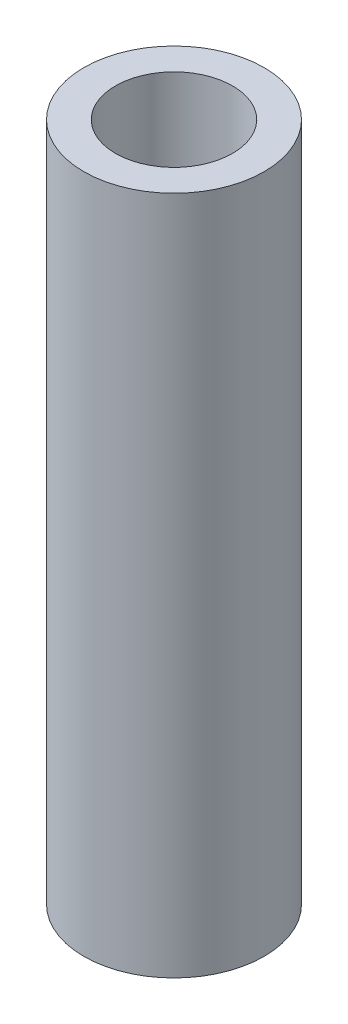
from build123d import *

# Parameters (mm, degrees)
SKETCH1_R           = 28.5
SKETCH1_R_2         = 18.5
BOSS_EXTRUDE1_DEPTH = 214.8
SKETCH2_R           = 12.53
CUT_EXTRUDE1_DEPTH  = 219.548713105


with BuildPart() as part:
    # Sketch1 → Boss-Extrude1 (new body)
    with BuildSketch(Plane(origin=(0, 0, 0), x_dir=(1, 0, 0), z_dir=(0, 1, 0))):
        Circle(SKETCH1_R)
        Circle(SKETCH1_R_2, mode=Mode.SUBTRACT)
    extrude(amount=BOSS_EXTRUDE1_DEPTH)

    # Sketch2 → Cut-Extrude1 (cut, through all)
    with BuildSketch(Plane(origin=(0, 0, 0), x_dir=(0, 0, -1), z_dir=(1, 0, 0))):
        with Locations((0, 150.1)):
            Circle(SKETCH2_R)
        with Locations((0, 90.1)):
            Circle(SKETCH2_R)
        with Locations((0, 30.1)):
            Circle(SKETCH2_R)
    extrude(amount=-CUT_EXTRUDE1_DEPTH, mode=Mode.SUBTRACT)


solid = part.part
